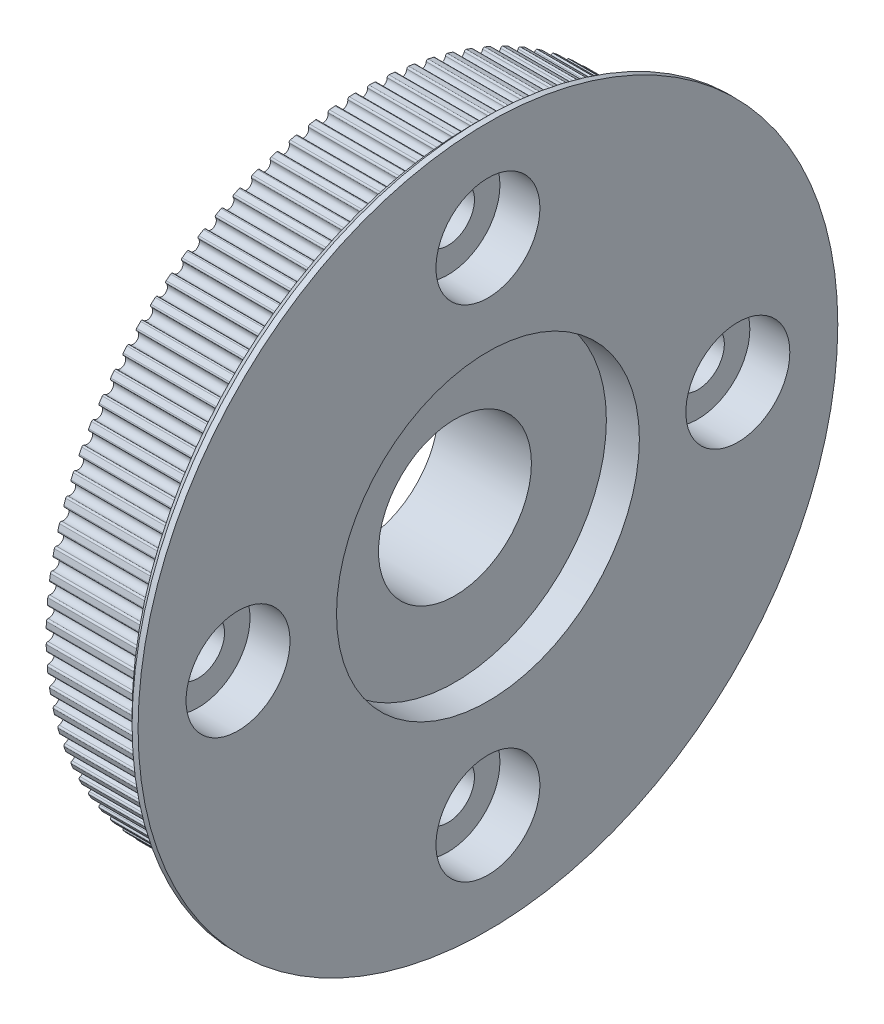
from build123d import *

# Parameters (mm, degrees)
SKETCH1_R               = 31.6
SKETCH1_R_2             = 7.65
BOSS_EXTRUDE1_DEPTH     = 11
SKETCH2_R               = 0.55
CUT_EXTRUDE1_DEPTH      = 11
FILLET1_R               = 0.16
SKETCH3_R               = 35
SKETCH3_R_2             = 7.65
BOSS_EXTRUDE2_DEPTH     = 1.6
CHAMFER1_SIZE           = 1
SKETCH8_R               = 15.15
CUT_EXTRUDE7_DEPTH      = 3.3
CROQUIS2_R              = 15.15
SALIENTE_EXTRUIR1_DEPTH = 9.3
CROQUIS3_R              = 7.65
CORTAR_EXTRUIR1_DEPTH   = 51.363578128
CROQUIS6_R              = 5.2
CORTAR_EXTRUIR2_DEPTH   = 4
CROQUIS7_R              = 2.65
CORTAR_EXTRUIR3_DEPTH   = 51.23902867
CROQUIS8_R              = 2.65
CORTAR_EXTRUIR4_DEPTH   = 51.23902867
CROQUIS9_R              = 2.65
CORTAR_EXTRUIR5_DEPTH   = 51.23902867
CROQUIS10_R             = 2.65
CORTAR_EXTRUIR6_DEPTH   = 51.23902867


with BuildPart() as part:
    # Sketch1 → Boss-Extrude1 (new body)
    with BuildSketch(Plane(origin=(0, 0, 0), x_dir=(0, 0, -1), z_dir=(1, 0, 0))):
        Circle(SKETCH1_R)
        Circle(SKETCH1_R_2, mode=Mode.SUBTRACT)
    extrude(amount=BOSS_EXTRUDE1_DEPTH)

    # Sketch2 → Cut-Extrude1 (cut)
    with BuildSketch(Plane(origin=(0, 0, 0), x_dir=(0, 0, -1), z_dir=(1, 0, 0))):
        with Locations((0, 31.39)):
            Circle(SKETCH2_R)
        with Locations((1.970994408, 31.328059005)):
            Circle(SKETCH2_R)
        with Locations((3.934210202, 31.142480474)):
            Circle(SKETCH2_R)
        with Locations((5.881899465, 30.8339968)):
            Circle(SKETCH2_R)
        with Locations((7.806375558, 30.403825428)):
            Circle(SKETCH2_R)
        with Locations((9.700043453, 29.853664047)):
            Circle(SKETCH2_R)
        with Locations((11.555429709, 29.185683892)):
            Circle(SKETCH2_R)
        with Locations((13.365211962, 28.402521177)):
            Circle(SKETCH2_R)
        with Locations((15.12224783, 27.507266687)):
            Circle(SKETCH2_R)
        with Locations((16.819603094, 26.503453582)):
            Circle(SKETCH2_R)
        with Locations((18.450579069, 25.395043453)):
            Circle(SKETCH2_R)
        with Locations((20.008739038, 24.186410691)):
            Circle(SKETCH2_R)
        with Locations((21.487933655, 22.882325215)):
            Circle(SKETCH2_R)
        with Locations((22.882325215, 21.487933655)):
            Circle(SKETCH2_R)
        with Locations((24.186410691, 20.008739038)):
            Circle(SKETCH2_R)
        with Locations((25.395043453, 18.450579069)):
            Circle(SKETCH2_R)
        with Locations((26.503453582, 16.819603094)):
            Circle(SKETCH2_R)
        with Locations((27.507266687, 15.12224783)):
            Circle(SKETCH2_R)
        with Locations((28.402521177, 13.365211962)):
            Circle(SKETCH2_R)
        with Locations((29.185683892, 11.555429709)):
            Circle(SKETCH2_R)
        with Locations((29.853664047, 9.700043453)):
            Circle(SKETCH2_R)
        with Locations((30.403825428, 7.806375558)):
            Circle(SKETCH2_R)
        with Locations((30.8339968, 5.881899465)):
            Circle(SKETCH2_R)
        with Locations((31.142480474, 3.934210202)):
            Circle(SKETCH2_R)
        with Locations((31.328059005, 1.970994408)):
            Circle(SKETCH2_R)
        with Locations((31.39, 0)):
            Circle(SKETCH2_R)
        with Locations((31.328059005, -1.970994408)):
            Circle(SKETCH2_R)
        with Locations((31.142480474, -3.934210202)):
            Circle(SKETCH2_R)
        with Locations((30.8339968, -5.881899465)):
            Circle(SKETCH2_R)
        with Locations((30.403825428, -7.806375558)):
            Circle(SKETCH2_R)
        with Locations((29.853664047, -9.700043453)):
            Circle(SKETCH2_R)
        with Locations((29.185683892, -11.555429709)):
            Circle(SKETCH2_R)
        with Locations((28.402521177, -13.365211962)):
            Circle(SKETCH2_R)
        with Locations((27.507266687, -15.12224783)):
            Circle(SKETCH2_R)
        with Locations((26.503453582, -16.819603094)):
            Circle(SKETCH2_R)
        with Locations((25.395043453, -18.450579069)):
            Circle(SKETCH2_R)
        with Locations((24.186410691, -20.008739038)):
            Circle(SKETCH2_R)
        with Locations((22.882325215, -21.487933655)):
            Circle(SKETCH2_R)
        with Locations((21.487933655, -22.882325215)):
            Circle(SKETCH2_R)
        with Locations((20.008739038, -24.186410691)):
            Circle(SKETCH2_R)
        with Locations((18.450579069, -25.395043453)):
            Circle(SKETCH2_R)
        with Locations((16.819603094, -26.503453582)):
            Circle(SKETCH2_R)
        with Locations((15.12224783, -27.507266687)):
            Circle(SKETCH2_R)
        with Locations((13.365211962, -28.402521177)):
            Circle(SKETCH2_R)
        with Locations((11.555429709, -29.185683892)):
            Circle(SKETCH2_R)
        with Locations((9.700043453, -29.853664047)):
            Circle(SKETCH2_R)
        with Locations((7.806375558, -30.403825428)):
            Circle(SKETCH2_R)
        with Locations((5.881899465, -30.8339968)):
            Circle(SKETCH2_R)
        with Locations((3.934210202, -31.142480474)):
            Circle(SKETCH2_R)
        with Locations((1.970994408, -31.328059005)):
            Circle(SKETCH2_R)
        with Locations((0, -31.39)):
            Circle(SKETCH2_R)
        with Locations((-1.970994408, -31.328059005)):
            Circle(SKETCH2_R)
        with Locations((-3.934210202, -31.142480474)):
            Circle(SKETCH2_R)
        with Locations((-5.881899465, -30.8339968)):
            Circle(SKETCH2_R)
        with Locations((-7.806375558, -30.403825428)):
            Circle(SKETCH2_R)
        with Locations((-9.700043453, -29.853664047)):
            Circle(SKETCH2_R)
        with Locations((-11.555429709, -29.185683892)):
            Circle(SKETCH2_R)
        with Locations((-13.365211962, -28.402521177)):
            Circle(SKETCH2_R)
        with Locations((-15.12224783, -27.507266687)):
            Circle(SKETCH2_R)
        with Locations((-16.819603094, -26.503453582)):
            Circle(SKETCH2_R)
        with Locations((-18.450579069, -25.395043453)):
            Circle(SKETCH2_R)
        with Locations((-20.008739038, -24.186410691)):
            Circle(SKETCH2_R)
        with Locations((-21.487933655, -22.882325215)):
            Circle(SKETCH2_R)
        with Locations((-22.882325215, -21.487933655)):
            Circle(SKETCH2_R)
        with Locations((-24.186410691, -20.008739038)):
            Circle(SKETCH2_R)
        with Locations((-25.395043453, -18.450579069)):
            Circle(SKETCH2_R)
        with Locations((-26.503453582, -16.819603094)):
            Circle(SKETCH2_R)
        with Locations((-27.507266687, -15.12224783)):
            Circle(SKETCH2_R)
        with Locations((-28.402521177, -13.365211962)):
            Circle(SKETCH2_R)
        with Locations((-29.185683892, -11.555429709)):
            Circle(SKETCH2_R)
        with Locations((-29.853664047, -9.700043453)):
            Circle(SKETCH2_R)
        with Locations((-30.403825428, -7.806375558)):
            Circle(SKETCH2_R)
        with Locations((-30.8339968, -5.881899465)):
            Circle(SKETCH2_R)
        with Locations((-31.142480474, -3.934210202)):
            Circle(SKETCH2_R)
        with Locations((-31.328059005, -1.970994408)):
            Circle(SKETCH2_R)
        with Locations((-31.39, 0)):
            Circle(SKETCH2_R)
        with Locations((-31.328059005, 1.970994408)):
            Circle(SKETCH2_R)
        with Locations((-31.142480474, 3.934210202)):
            Circle(SKETCH2_R)
        with Locations((-30.8339968, 5.881899465)):
            Circle(SKETCH2_R)
        with Locations((-30.403825428, 7.806375558)):
            Circle(SKETCH2_R)
        with Locations((-29.853664047, 9.700043453)):
            Circle(SKETCH2_R)
        with Locations((-29.185683892, 11.555429709)):
            Circle(SKETCH2_R)
        with Locations((-28.402521177, 13.365211962)):
            Circle(SKETCH2_R)
        with Locations((-27.507266687, 15.12224783)):
            Circle(SKETCH2_R)
        with Locations((-26.503453582, 16.819603094)):
            Circle(SKETCH2_R)
        with Locations((-25.395043453, 18.450579069)):
            Circle(SKETCH2_R)
        with Locations((-24.186410691, 20.008739038)):
            Circle(SKETCH2_R)
        with Locations((-22.882325215, 21.487933655)):
            Circle(SKETCH2_R)
        with Locations((-21.487933655, 22.882325215)):
            Circle(SKETCH2_R)
        with Locations((-20.008739038, 24.186410691)):
            Circle(SKETCH2_R)
        with Locations((-18.450579069, 25.395043453)):
            Circle(SKETCH2_R)
        with Locations((-16.819603094, 26.503453582)):
            Circle(SKETCH2_R)
        with Locations((-15.12224783, 27.507266687)):
            Circle(SKETCH2_R)
        with Locations((-13.365211962, 28.402521177)):
            Circle(SKETCH2_R)
        with Locations((-11.555429709, 29.185683892)):
            Circle(SKETCH2_R)
        with Locations((-9.700043453, 29.853664047)):
            Circle(SKETCH2_R)
        with Locations((-7.806375558, 30.403825428)):
            Circle(SKETCH2_R)
        with Locations((-5.881899465, 30.8339968)):
            Circle(SKETCH2_R)
        with Locations((-3.934210202, 31.142480474)):
            Circle(SKETCH2_R)
        with Locations((-1.970994408, 31.328059005)):
            Circle(SKETCH2_R)
    extrude(amount=CUT_EXTRUDE1_DEPTH, mode=Mode.SUBTRACT)

    # Fillet1
    fillet1_edges = [part.edges().sort_by_distance(p)[0] for p in [
        (5.5, 31.59588404, 0.510011532),
        (5.5, 31.59588404, -0.510011532),
        (5.5, 31.501512891, 2.492927114),
        (5.5, 31.565560669, 1.474916834),
        (5.5, 31.282819662, 4.466004252),
        (5.5, 31.410662451, 3.454024376),
        (5.5, 30.940667436, 6.421456112),
        (5.5, 31.131800699, 5.419500462),
        (5.5, 30.476406531, 8.351565418),
        (5.5, 30.730075952, 7.363588255),
        (5.5, 29.891869173, 10.248714911),
        (5.5, 30.207073634, 9.27861533),
        (5.5, 29.189362264, 12.105417408),
        (5.5, 29.564857798, 11.157023949),
        (5.5, 28.371658277, 13.914345353),
        (5.5, 28.805962974, 12.991400892),
        (5.5, 27.441984317, 15.668359734),
        (5.5, 27.933384175, 14.774506711),
        (5.5, 26.404009381, 17.360538258),
        (5.5, 26.95056507, 16.499304301),
        (5.5, 25.261829884, 18.984202668),
        (5.5, 25.861384397, 18.158986675),
        (5.5, 24.019953484, 20.532945103),
        (5.5, 24.670140655, 19.747003825),
        (5.5, 22.683281303, 22.000653385),
        (5.5, 23.381535138, 21.257088572),
        (5.5, 21.257088572, 23.381535138),
        (5.5, 22.000653385, 22.683281303),
        (5.5, 19.747003825, 24.670140655),
        (5.5, 20.532945103, 24.019953484),
        (5.5, 18.158986675, 25.861384397),
        (5.5, 18.984202668, 25.261829884),
        (5.5, 16.499304301, 26.95056507),
        (5.5, 17.360538258, 26.404009381),
        (5.5, 14.774506711, 27.933384175),
        (5.5, 15.668359734, 27.441984317),
        (5.5, 12.991400892, 28.805962974),
        (5.5, 13.914345353, 28.371658277),
        (5.5, 11.157023949, 29.564857798),
        (5.5, 12.105417408, 29.189362264),
        (5.5, 9.27861533, 30.207073634),
        (5.5, 10.248714911, 29.891869173),
        (5.5, 7.363588255, 30.730075952),
        (5.5, 8.351565418, 30.476406531),
        (5.5, 5.419500462, 31.131800699),
        (5.5, 6.421456112, 30.940667436),
        (5.5, 3.454024376, 31.410662451),
        (5.5, 4.466004252, 31.282819662),
        (5.5, 1.474916834, 31.565560669),
        (5.5, 2.492927114, 31.501512891),
        (5.5, -0.510011532, 31.59588404),
        (5.5, 0.510011532, 31.59588404),
        (5.5, -2.492927114, 31.501512891),
        (5.5, -1.474916834, 31.565560669),
        (5.5, -4.466004252, 31.282819662),
        (5.5, -3.454024376, 31.410662451),
        (5.5, -6.421456112, 30.940667436),
        (5.5, -5.419500462, 31.131800699),
        (5.5, -8.351565418, 30.476406531),
        (5.5, -7.363588255, 30.730075952),
        (5.5, -10.248714911, 29.891869173),
        (5.5, -9.27861533, 30.207073634),
        (5.5, -12.105417408, 29.189362264),
        (5.5, -11.157023949, 29.564857798),
        (5.5, -13.914345353, 28.371658277),
        (5.5, -12.991400892, 28.805962974),
        (5.5, -15.668359734, 27.441984317),
        (5.5, -14.774506711, 27.933384175),
        (5.5, -17.360538258, 26.404009381),
        (5.5, -16.499304301, 26.95056507),
        (5.5, -18.984202668, 25.261829884),
        (5.5, -18.158986675, 25.861384397),
        (5.5, -20.532945103, 24.019953484),
        (5.5, -19.747003825, 24.670140655),
        (5.5, -22.000653385, 22.683281303),
        (5.5, -21.257088572, 23.381535138),
        (5.5, -23.381535138, 21.257088572),
        (5.5, -22.683281303, 22.000653385),
        (5.5, -24.670140655, 19.747003825),
        (5.5, -24.019953484, 20.532945103),
        (5.5, -25.861384397, 18.158986675),
        (5.5, -25.261829884, 18.984202668),
        (5.5, -26.95056507, 16.499304301),
        (5.5, -26.404009381, 17.360538258),
        (5.5, -27.933384175, 14.774506711),
        (5.5, -27.441984317, 15.668359734),
        (5.5, -28.805962974, 12.991400892),
        (5.5, -28.371658277, 13.914345353),
        (5.5, -29.564857798, 11.157023949),
        (5.5, -29.189362264, 12.105417408),
        (5.5, -30.207073634, 9.27861533),
        (5.5, -29.891869173, 10.248714911),
        (5.5, -30.730075952, 7.363588255),
        (5.5, -30.476406531, 8.351565418),
        (5.5, -31.131800699, 5.419500462),
        (5.5, -30.940667436, 6.421456112),
        (5.5, -31.410662451, 3.454024376),
        (5.5, -31.282819662, 4.466004252),
        (5.5, -31.565560669, 1.474916834),
        (5.5, -31.501512891, 2.492927114),
        (5.5, -31.59588404, -0.510011532),
        (5.5, -31.59588404, 0.510011532),
        (5.5, -31.501512891, -2.492927114),
        (5.5, -31.565560669, -1.474916834),
        (5.5, -31.282819662, -4.466004252),
        (5.5, -31.410662451, -3.454024376),
        (5.5, -30.940667436, -6.421456112),
        (5.5, -31.131800699, -5.419500462),
        (5.5, -30.476406531, -8.351565418),
        (5.5, -30.730075952, -7.363588255),
        (5.5, -29.891869173, -10.248714911),
        (5.5, -30.207073634, -9.27861533),
        (5.5, -29.189362264, -12.105417408),
        (5.5, -29.564857798, -11.157023949),
        (5.5, -28.371658277, -13.914345353),
        (5.5, -28.805962974, -12.991400892),
        (5.5, -27.441984317, -15.668359734),
        (5.5, -27.933384175, -14.774506711),
        (5.5, -26.404009381, -17.360538258),
        (5.5, -26.95056507, -16.499304301),
        (5.5, -25.261829884, -18.984202668),
        (5.5, -25.861384397, -18.158986675),
        (5.5, -24.019953484, -20.532945103),
        (5.5, -24.670140655, -19.747003825),
        (5.5, -22.683281303, -22.000653385),
        (5.5, -23.381535138, -21.257088572),
        (5.5, -21.257088572, -23.381535138),
        (5.5, -22.000653385, -22.683281303),
        (5.5, -19.747003825, -24.670140655),
        (5.5, -20.532945103, -24.019953484),
        (5.5, -18.158986675, -25.861384397),
        (5.5, -18.984202668, -25.261829884),
        (5.5, -16.499304301, -26.95056507),
        (5.5, -17.360538258, -26.404009381),
        (5.5, -14.774506711, -27.933384175),
        (5.5, -15.668359734, -27.441984317),
        (5.5, -12.991400892, -28.805962974),
        (5.5, -13.914345353, -28.371658277),
        (5.5, -11.157023949, -29.564857798),
        (5.5, -12.105417408, -29.189362264),
        (5.5, -9.27861533, -30.207073634),
        (5.5, -10.248714911, -29.891869173),
        (5.5, -7.363588255, -30.730075952),
        (5.5, -8.351565418, -30.476406531),
        (5.5, -5.419500462, -31.131800699),
        (5.5, -6.421456112, -30.940667436),
        (5.5, -3.454024376, -31.410662451),
        (5.5, -4.466004252, -31.282819662),
        (5.5, -1.474916834, -31.565560669),
        (5.5, -2.492927114, -31.501512891),
        (5.5, 0.510011532, -31.59588404),
        (5.5, -0.510011532, -31.59588404),
        (5.5, 2.492927114, -31.501512891),
        (5.5, 1.474916834, -31.565560669),
        (5.5, 4.466004252, -31.282819662),
        (5.5, 3.454024376, -31.410662451),
        (5.5, 6.421456112, -30.940667436),
        (5.5, 5.419500462, -31.131800699),
        (5.5, 8.351565418, -30.476406531),
        (5.5, 7.363588255, -30.730075952),
        (5.5, 10.248714911, -29.891869173),
        (5.5, 9.27861533, -30.207073634),
        (5.5, 12.105417408, -29.189362264),
        (5.5, 11.157023949, -29.564857798),
        (5.5, 13.914345353, -28.371658277),
        (5.5, 12.991400892, -28.805962974),
        (5.5, 15.668359734, -27.441984317),
        (5.5, 14.774506711, -27.933384175),
        (5.5, 17.360538258, -26.404009381),
        (5.5, 16.499304301, -26.95056507),
        (5.5, 18.984202668, -25.261829884),
        (5.5, 18.158986675, -25.861384397),
        (5.5, 20.532945103, -24.019953484),
        (5.5, 19.747003825, -24.670140655),
        (5.5, 22.000653385, -22.683281303),
        (5.5, 21.257088572, -23.381535138),
        (5.5, 23.381535138, -21.257088572),
        (5.5, 22.683281303, -22.000653385),
        (5.5, 24.670140655, -19.747003825),
        (5.5, 24.019953484, -20.532945103),
        (5.5, 25.861384397, -18.158986675),
        (5.5, 25.261829884, -18.984202668),
        (5.5, 26.95056507, -16.499304301),
        (5.5, 26.404009381, -17.360538258),
        (5.5, 27.933384175, -14.774506711),
        (5.5, 27.441984317, -15.668359734),
        (5.5, 28.805962974, -12.991400892),
        (5.5, 28.371658277, -13.914345353),
        (5.5, 29.564857798, -11.157023949),
        (5.5, 29.189362264, -12.105417408),
        (5.5, 30.207073634, -9.27861533),
        (5.5, 29.891869173, -10.248714911),
        (5.5, 30.730075952, -7.363588255),
        (5.5, 30.476406531, -8.351565418),
        (5.5, 31.131800699, -5.419500462),
        (5.5, 30.940667436, -6.421456112),
        (5.5, 31.410662451, -3.454024376),
        (5.5, 31.282819662, -4.466004252),
        (5.5, 31.565560669, -1.474916834),
        (5.5, 31.501512891, -2.492927114),
    ]]
    fillet(fillet1_edges, radius=FILLET1_R)

    # Sketch3 → Boss-Extrude2 (add)
    with BuildSketch(Plane(origin=(11, 0, 0), x_dir=(0, 0, -1), z_dir=(1, 0, 0))):
        Circle(SKETCH3_R)
        Circle(SKETCH3_R_2, mode=Mode.SUBTRACT)
    extrude(amount=BOSS_EXTRUDE2_DEPTH)

    # Chamfer1
    chamfer1_edges = [part.edges().sort_by_distance(p)[0] for p in [
        (11, 0, 35),
    ]]
    chamfer(chamfer1_edges, length=CHAMFER1_SIZE)

    # Sketch8 → Cut-Extrude7 (cut)
    with BuildSketch(Plane(origin=(12.6, 0, 0), x_dir=(0, 0, -1), z_dir=(1, 0, 0))):
        Circle(SKETCH8_R)
    extrude(amount=-CUT_EXTRUDE7_DEPTH, mode=Mode.SUBTRACT)

    # Croquis2 → Saliente-Extruir1 (add)
    with BuildSketch(Plane(origin=(9.3, 0, 0), x_dir=(0, 0, -1), z_dir=(1, 0, 0))):
        Circle(CROQUIS2_R)
    extrude(amount=-SALIENTE_EXTRUIR1_DEPTH)

    # Croquis3 → Cortar-Extruir1 (cut, through all)
    with BuildSketch(Plane(origin=(9.3, 0, 0), x_dir=(0, 0, -1), z_dir=(1, 0, 0))):
        Circle(CROQUIS3_R)
    extrude(amount=-CORTAR_EXTRUIR1_DEPTH, mode=Mode.SUBTRACT)

    # Croquis6 → Cortar-Extruir2 (cut)
    with BuildSketch(Plane(origin=(12.6, 0, 0), x_dir=(0, 0, -1), z_dir=(1, 0, 0))):
        with Locations((0, -25)):
            Circle(CROQUIS6_R)
        with Locations((25, 0)):
            Circle(CROQUIS6_R)
        with Locations((-25, 0)):
            Circle(CROQUIS6_R)
        with Locations((0, 25)):
            Circle(CROQUIS6_R)
    extrude(amount=-CORTAR_EXTRUIR2_DEPTH, mode=Mode.SUBTRACT)

    # Croquis7 → Cortar-Extruir3 (cut, through all)
    with BuildSketch(Plane(origin=(8.6, 0, 0), x_dir=(0, 0, -1), z_dir=(1, 0, 0))):
        with Locations((0, -25)):
            Circle(CROQUIS7_R)
    extrude(amount=-CORTAR_EXTRUIR3_DEPTH, mode=Mode.SUBTRACT)

    # Croquis8 → Cortar-Extruir4 (cut, through all)
    with BuildSketch(Plane(origin=(8.6, 0, 0), x_dir=(0, 0, -1), z_dir=(1, 0, 0))):
        with Locations((-25, 0)):
            Circle(CROQUIS8_R)
    extrude(amount=-CORTAR_EXTRUIR4_DEPTH, mode=Mode.SUBTRACT)

    # Croquis9 → Cortar-Extruir5 (cut, through all)
    with BuildSketch(Plane(origin=(8.6, 0, 0), x_dir=(0, 0, -1), z_dir=(1, 0, 0))):
        with Locations((25, 0)):
            Circle(CROQUIS9_R)
    extrude(amount=-CORTAR_EXTRUIR5_DEPTH, mode=Mode.SUBTRACT)

    # Croquis10 → Cortar-Extruir6 (cut, through all)
    with BuildSketch(Plane(origin=(8.6, 0, 0), x_dir=(0, 0, -1), z_dir=(1, 0, 0))):
        with Locations((0, 25)):
            Circle(CROQUIS10_R)
    extrude(amount=-CORTAR_EXTRUIR6_DEPTH, mode=Mode.SUBTRACT)


solid = part.part
